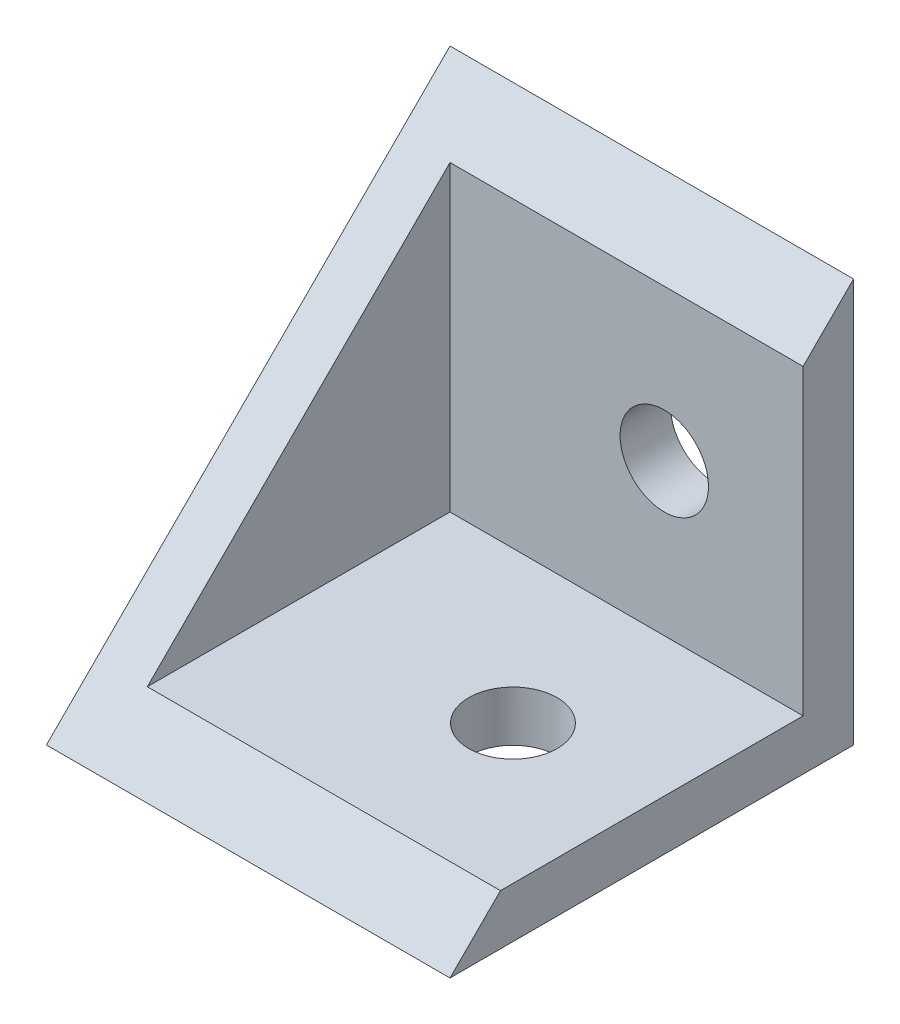
from build123d import *

# Parameters (mm, degrees)
SKETCH1_W               = 25.4
SKETCH1_H               = 25.4
BOSS_EXTRUDE1_DEPTH     = 25.4
CUT_EXTRUDE1_DEPTH      = 25.4
CUT_EXTRUDE2_DEPTH      = 39.1
CUT_EXTRUDE2_DEPTH_BACK = 22.225
SKETCH4_R               = 2.7813
CUT_EXTRUDE3_DEPTH      = 22.225
SKETCH5_R               = 2.7813
CUT_EXTRUDE4_DEPTH      = 22.225


with BuildPart() as part:
    # Sketch1 → Boss-Extrude1 (new body)
    with BuildSketch(Plane(origin=(0, 0, 0), x_dir=(1, 0, 0), z_dir=(0, 1, 0))):
        Rectangle(SKETCH1_W, SKETCH1_H)
    extrude(amount=BOSS_EXTRUDE1_DEPTH)

    # Sketch2 → Cut-Extrude1 (cut)
    with BuildSketch(Plane(origin=(12.7, 0, 0), x_dir=(0, 0, -1), z_dir=(1, 0, 0))):
        Polygon((-12.7, 25.4), (12.7, 25.4), (-12.7, 0), align=None)
    extrude(amount=-CUT_EXTRUDE1_DEPTH, mode=Mode.SUBTRACT)

    # Sketch3 → Cut-Extrude2 (cut, two sides: drawn at the far end of the back side and taken through both)
    with BuildSketch(Plane(origin=(12.7, 0, 0), x_dir=(0, 0, -1), z_dir=(1, 0, 0)).offset(-CUT_EXTRUDE2_DEPTH_BACK)):
        Polygon((-82.386792847, 3.175), (-9.525, 3.175), (9.525, 3.175), (9.525, 22.225), (9.525, 95.086792847), (-93.517135624, 198.128928471), (-185.428928471, 106.217135624), align=None)
    extrude(amount=CUT_EXTRUDE2_DEPTH + CUT_EXTRUDE2_DEPTH_BACK, mode=Mode.SUBTRACT)

    # Sketch4 → Cut-Extrude3 (cut)
    with BuildSketch(Plane.XY.offset(-9.525)):
        with Locations((3.9624, 12.7)):
            Circle(SKETCH4_R)
    extrude(amount=-CUT_EXTRUDE3_DEPTH, mode=Mode.SUBTRACT)

    # Sketch5 → Cut-Extrude4 (cut)
    with BuildSketch(Plane(origin=(0, 3.175, 0), x_dir=(1, 0, 0), z_dir=(0, 1, 0))):
        with Locations((3.9624, 0)):
            Circle(SKETCH5_R)
    extrude(amount=-CUT_EXTRUDE4_DEPTH, mode=Mode.SUBTRACT)


solid = part.part
